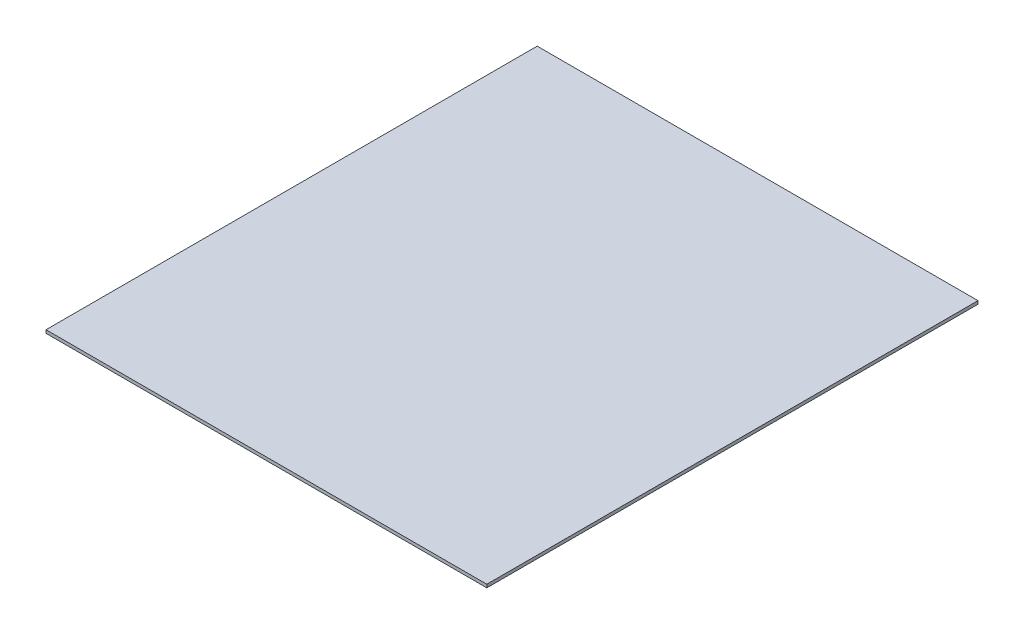
from build123d import *

# Parameters (mm, degrees)
SKETCH1_W           = 444.5
SKETCH1_H           = 495.3
BOSS_EXTRUDE1_DEPTH = 3.175


with BuildPart() as part:
    # Sketch1 → Boss-Extrude1 (new body)
    with BuildSketch(Plane(origin=(0, 0, 0), x_dir=(1, 0, 0), z_dir=(0, 1, 0))):
        Rectangle(SKETCH1_W, SKETCH1_H)
    extrude(amount=BOSS_EXTRUDE1_DEPTH)


solid = part.part
